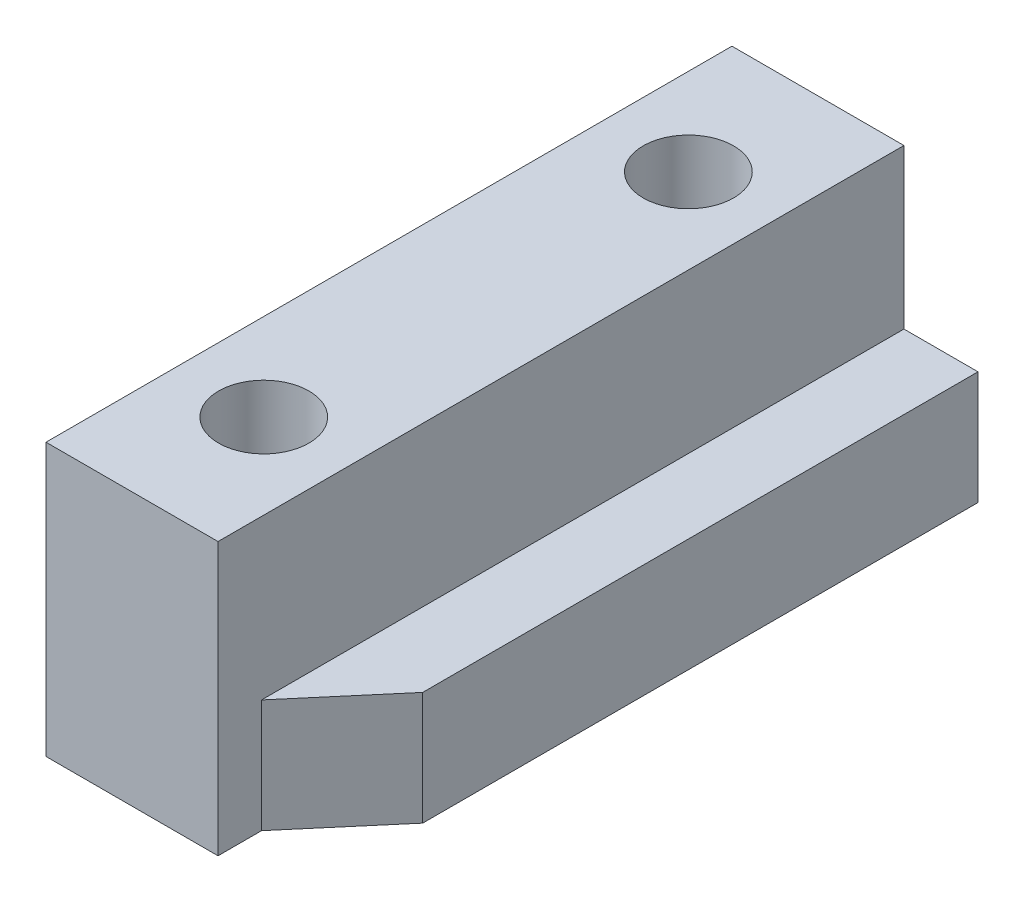
from build123d import *

# Parameters (mm, degrees)
BOSS_EXTRUDE1_DEPTH = 31.5
SKETCH2_R           = 2.075
CUT_EXTRUDE1_DEPTH  = 7
CUT_EXTRUDE2_DEPTH  = 10


with BuildPart() as part:
    # Sketch1 → Boss-Extrude1 (new body)
    with BuildSketch(Plane.XY):
        Polygon((0, 0), (0, 12.5), (7.9, 12.5), (7.9, 5.2), (11.3, 5.2), (11.3, 0), align=None)
    extrude(amount=-BOSS_EXTRUDE1_DEPTH)

    # Sketch2 → Cut-Extrude1 (cut)
    with BuildSketch(Plane(origin=(0, 12.5, 0), x_dir=(1, 0, 0), z_dir=(0, 1, 0))):
        with Locations((4, 6)):
            Circle(SKETCH2_R)
        with Locations((4, 25.5)):
            Circle(SKETCH2_R)
    extrude(amount=-CUT_EXTRUDE1_DEPTH, mode=Mode.SUBTRACT)

    # Sketch3 → Cut-Extrude2 (cut)
    with BuildSketch(Plane.XZ):
        Polygon((7.9, -2), (7.9, 0), (11.3, 0), (11.3, -6), align=None)
    extrude(amount=-CUT_EXTRUDE2_DEPTH, mode=Mode.SUBTRACT)


solid = part.part
